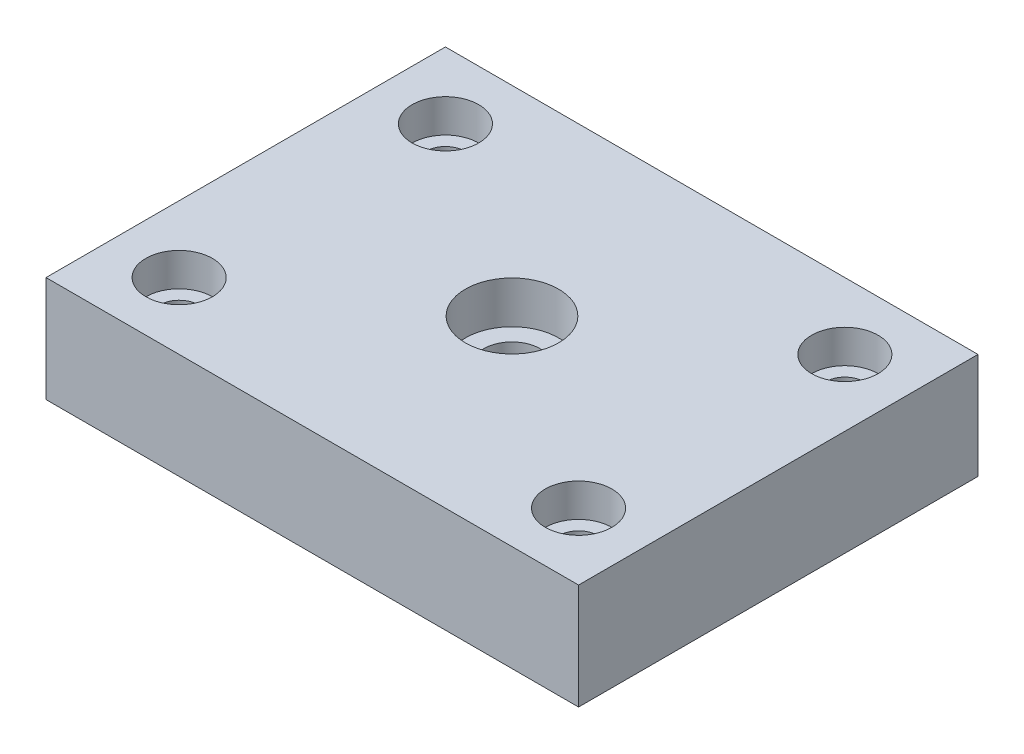
from build123d import *

# Parameters (mm, degrees)
SKETCH1_W                         = 80
SKETCH1_H                         = 60
BASE_FLANGE1_DEPTH                = 15.875
CBORE_FOR_M5_SHCS1_D              = 5.8
CBORE_FOR_M5_SHCS1_CBORE_D        = 10
CBORE_FOR_M5_SHCS1_CBORE_DEPTH    = 5
F_3_8_24_TAPPED_HOLE1_D           = 8.4328
F_3_8_24_TAPPED_HOLE1_CBORE_D     = 14
F_3_8_24_TAPPED_HOLE1_CBORE_DEPTH = 6.35


# Sheet-metal steps are written as plain solids
with BuildPart() as part:
    # Sketch1 → Base-Flange1 (new body)
    with BuildSketch(Plane(origin=(0, 0, 0), x_dir=(1, 0, 0), z_dir=(0, 1, 0))):
        Rectangle(SKETCH1_W, SKETCH1_H)
    extrude(amount=-BASE_FLANGE1_DEPTH)

    # CBORE for M5 SHCS1 (through all)
    with Locations(Plane(origin=(0, 0, 0), x_dir=(1, 0, 0), z_dir=(0, 1, 0))):
        with Locations((-30, -20), (-30, 20), (30, 20), (30, -20)):
            CounterBoreHole(CBORE_FOR_M5_SHCS1_D / 2, CBORE_FOR_M5_SHCS1_CBORE_D / 2, CBORE_FOR_M5_SHCS1_CBORE_DEPTH)

    # 3/8-24 Tapped Hole1 (through all)
    with Locations(Plane(origin=(0, 0, 0), x_dir=(1, 0, 0), z_dir=(0, 1, 0))):
        with Locations((0, 0)):
            CounterBoreHole(F_3_8_24_TAPPED_HOLE1_D / 2, F_3_8_24_TAPPED_HOLE1_CBORE_D / 2, F_3_8_24_TAPPED_HOLE1_CBORE_DEPTH)


solid = part.part
